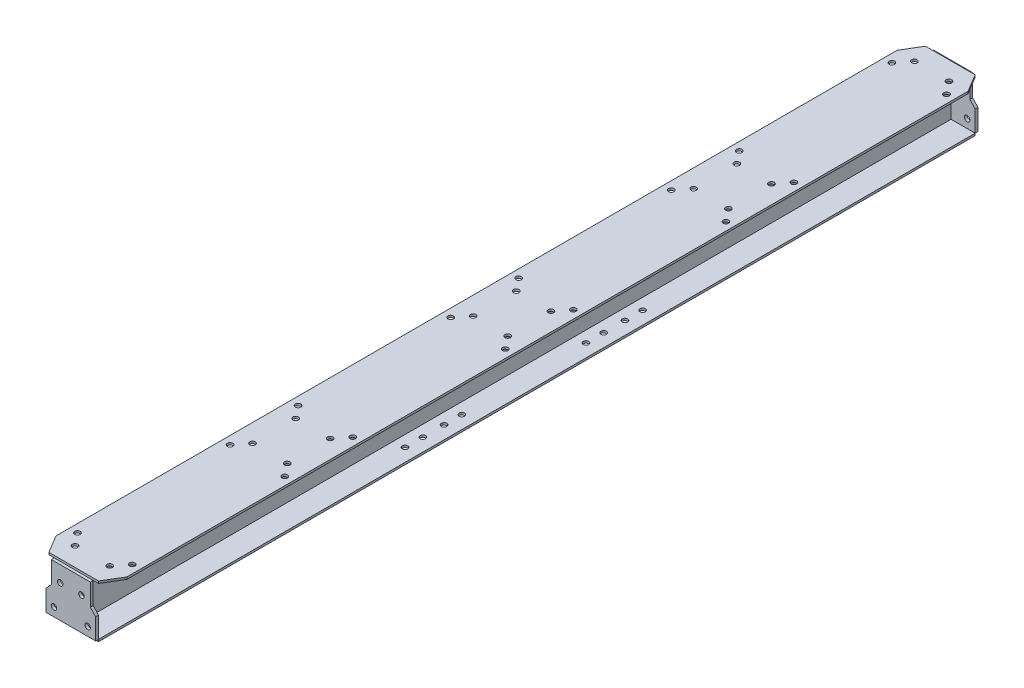
from build123d import *

# Parameters (mm, degrees)
EXTRUDE_1_DEPTH      = 2472
EXTRUDE_2_DEPTH      = 16
SKETCH_5_R           = 15.5
CUT_EXTRUDE_5_DEPTH  = 16
SKETCH_4_R           = 15.5
CUT_EXTRUDE_3_DEPTH  = 2501.439211419
CUT_EXTRUDE_6_DEPTH  = 2501.439211419
SKETCH_7_R           = 15.5
CUT_EXTRUDE_7_DEPTH  = 16
MIRROR_START         = 136.5
MIRROR_1_OUTLINE_R   = 15.5
MIRROR_1_DEPTH       = 12
MIRROR_START_2       = -148.5
MIRROR_1_2_OUTLINE_W = 280
MIRROR_1_2_OUTLINE_H = 2472
MIRROR_1_2_OUTLINE_R = 15.5
MIRROR_1_2_DEPTH     = 12
MIRROR_START_3       = -136.5
MIRROR_1_3_OUTLINE_W = 8
MIRROR_1_3_OUTLINE_H = 2472
MIRROR_1_3_DEPTH     = 273


# Read off the part's stored shape, not the designer's step: 镜向1
with BuildPart() as part:
    # 草图2 → 拉伸1 (new body)
    with BuildSketch(Plane.XY):
        Polygon((-4, 136.5), (-4, -136.5), (-140, -136.5), (-140, -148.5), (140, -148.5), (140, -136.5), (4, -136.5), (4, 136.5), (200, 136.5), (200, 148.5), (-200, 148.5), (-200, 136.5), align=None)
    extrude(amount=EXTRUDE_1_DEPTH)

    # 草图5 → 拉伸5 (cut)
    with BuildSketch(Plane(origin=(0, 148.5, 0), x_dir=(-1, 0, 0), z_dir=(0, 1, 0))):
        with Locations(Location((97.738221798, 2366.413652083, 0), (0, 0, 90))):
            Circle(SKETCH_5_R)
        with Locations(Location((154.125657451, 2296.267682131, 0), (0, 0, 90))):
            Circle(SKETCH_5_R)
        with Locations(Location((97.738221798, 1122.413652083, 0), (0, 0, 90))):
            Circle(SKETCH_5_R)
        with Locations(Location((154.125657451, 1052.267682131, 0), (0, 0, 90))):
            Circle(SKETCH_5_R)
        with Locations(Location((-97.738221798, 1365.586347917, 0), (0, 0, 90))):
            Circle(SKETCH_5_R)
        with Locations(Location((-154.125657451, 1435.732317869, 0), (0, 0, 90))):
            Circle(SKETCH_5_R)
        with Locations((154.125657451, 1435.732317869)):
            Circle(SKETCH_5_R)
        with Locations((97.738221798, 1365.586347917)):
            Circle(SKETCH_5_R)
        with Locations((-154.125657451, 1052.267682131)):
            Circle(SKETCH_5_R)
        with Locations((-97.738221798, 1122.413652083)):
            Circle(SKETCH_5_R)
        with Locations((-154.125657451, 2296.267682131)):
            Circle(SKETCH_5_R)
        with Locations((-97.738221798, 2366.413652083)):
            Circle(SKETCH_5_R)
        with Locations(Location((-97.738221798, 121.586347917, 0), (0, 0, 90))):
            Circle(SKETCH_5_R)
        with Locations(Location((-154.125657451, 191.732317869, 0), (0, 0, 90))):
            Circle(SKETCH_5_R)
        with Locations((154.125657451, 191.732317869)):
            Circle(SKETCH_5_R)
        with Locations((97.738221798, 121.586347917)):
            Circle(SKETCH_5_R)
    extrude(amount=-CUT_EXTRUDE_5_DEPTH, mode=Mode.SUBTRACT)

    # 草图6 → 拉伸6 (cut, through all)
    with BuildSketch(Plane(origin=(0, 0, 0), x_dir=(1, 0, 0), z_dir=(0, 1, 0))):
        Polygon((200, -2472), (140, -2472), (200, -2372), align=None)
        Polygon((-200, -2472), (-200, -2372), (-140, -2472), align=None)
    extrude(amount=CUT_EXTRUDE_6_DEPTH, mode=Mode.SUBTRACT)

    # 草图7 → 拉伸7 (cut)
    with BuildSketch(Plane(origin=(0, -136.5, 0), x_dir=(1, 0, 0), z_dir=(0, 1, 0))):
        with Locations(Location((67, -670, 0), (0, 0, 270))):
            Circle(SKETCH_7_R)
        with Locations(Location((67, -570, 0), (0, 0, 270))):
            Circle(SKETCH_7_R)
        with Locations(Location((67, -450, 0), (0, 0, 270))):
            Circle(SKETCH_7_R)
        with Locations(Location((67, -350, 0), (0, 0, 270))):
            Circle(SKETCH_7_R)
        with Locations(Location((-67, -350, 0), (0, 0, 180))):
            Circle(SKETCH_7_R)
        with Locations(Location((-67, -450, 0), (0, 0, 180))):
            Circle(SKETCH_7_R)
        with Locations(Location((-67, -570, 0), (0, 0, 180))):
            Circle(SKETCH_7_R)
        with Locations(Location((-67, -670, 0), (0, 0, 180))):
            Circle(SKETCH_7_R)
    extrude(amount=-CUT_EXTRUDE_7_DEPTH, mode=Mode.SUBTRACT)

    # 镜向1 outline → 镜向1 (add)
    with BuildSketch(Plane(origin=(0, 0, 0), x_dir=(1, 0, 0), z_dir=(0, 1, 0)).offset(MIRROR_START)):
        Polygon((-200, 2372), (-200, 0), (200, 0), (200, 2372), (140, 2472), (-140, 2472), align=None)
        with Locations((-154.125657451, 2296.267682131)):
            Circle(MIRROR_1_OUTLINE_R, mode=Mode.SUBTRACT)
        with Locations((-154.125657451, 1435.732317869)):
            Circle(MIRROR_1_OUTLINE_R, mode=Mode.SUBTRACT)
        with Locations((-154.125657451, 1052.267682131)):
            Circle(MIRROR_1_OUTLINE_R, mode=Mode.SUBTRACT)
        with Locations((-154.125657451, 191.732317869)):
            Circle(MIRROR_1_OUTLINE_R, mode=Mode.SUBTRACT)
        with Locations((-97.738221798, 1122.413652083)):
            Circle(MIRROR_1_OUTLINE_R, mode=Mode.SUBTRACT)
        with Locations((-97.738221798, 1365.586347917)):
            Circle(MIRROR_1_OUTLINE_R, mode=Mode.SUBTRACT)
        with Locations((-97.738221798, 2366.413652083)):
            Circle(MIRROR_1_OUTLINE_R, mode=Mode.SUBTRACT)
        with Locations((-97.738221798, 121.586347917)):
            Circle(MIRROR_1_OUTLINE_R, mode=Mode.SUBTRACT)
        with Locations((97.738221798, 2366.413652083)):
            Circle(MIRROR_1_OUTLINE_R, mode=Mode.SUBTRACT)
        with Locations((154.125657451, 2296.267682131)):
            Circle(MIRROR_1_OUTLINE_R, mode=Mode.SUBTRACT)
        with Locations((154.125657451, 1435.732317869)):
            Circle(MIRROR_1_OUTLINE_R, mode=Mode.SUBTRACT)
        with Locations((154.125657451, 1052.267682131)):
            Circle(MIRROR_1_OUTLINE_R, mode=Mode.SUBTRACT)
        with Locations((154.125657451, 191.732317869)):
            Circle(MIRROR_1_OUTLINE_R, mode=Mode.SUBTRACT)
        with Locations((97.738221798, 121.586347917)):
            Circle(MIRROR_1_OUTLINE_R, mode=Mode.SUBTRACT)
        with Locations((97.738221798, 1122.413652083)):
            Circle(MIRROR_1_OUTLINE_R, mode=Mode.SUBTRACT)
        with Locations((97.738221798, 1365.586347917)):
            Circle(MIRROR_1_OUTLINE_R, mode=Mode.SUBTRACT)
    extrude(amount=MIRROR_1_DEPTH)

    # Mirror 1 2 outline → Mirror 1 2 (add)
    with BuildSketch(Plane(origin=(0, 0, 0), x_dir=(1, 0, 0), z_dir=(0, 1, 0)).offset(MIRROR_START_2)):
        with Locations((0, 1236)):
            Rectangle(MIRROR_1_2_OUTLINE_W, MIRROR_1_2_OUTLINE_H)
        with Locations((-67, 350)):
            Circle(MIRROR_1_2_OUTLINE_R, mode=Mode.SUBTRACT)
        with Locations((-67, 450)):
            Circle(MIRROR_1_2_OUTLINE_R, mode=Mode.SUBTRACT)
        with Locations((-67, 570)):
            Circle(MIRROR_1_2_OUTLINE_R, mode=Mode.SUBTRACT)
        with Locations((-67, 670)):
            Circle(MIRROR_1_2_OUTLINE_R, mode=Mode.SUBTRACT)
        with Locations((67, 350)):
            Circle(MIRROR_1_2_OUTLINE_R, mode=Mode.SUBTRACT)
        with Locations((67, 450)):
            Circle(MIRROR_1_2_OUTLINE_R, mode=Mode.SUBTRACT)
        with Locations((67, 570)):
            Circle(MIRROR_1_2_OUTLINE_R, mode=Mode.SUBTRACT)
        with Locations((67, 670)):
            Circle(MIRROR_1_2_OUTLINE_R, mode=Mode.SUBTRACT)
    extrude(amount=MIRROR_1_2_DEPTH)

    # Mirror 1 3 outline → Mirror 1 3 (add)
    with BuildSketch(Plane(origin=(0, 0, 0), x_dir=(1, 0, 0), z_dir=(0, 1, 0)).offset(MIRROR_START_3)):
        with Locations((0, 1236)):
            Rectangle(MIRROR_1_3_OUTLINE_W, MIRROR_1_3_OUTLINE_H)
    extrude(amount=MIRROR_1_3_DEPTH)


with BuildPart() as body_2:
    # 草图3 → 拉伸2 (new body)
    with BuildSketch(Plane.XY.offset(2472)):
        Polygon((-110, 136.5), (110, 136.5), (110, 13.5), (140, -18.5), (140, -136.5), (-140, -136.5), (-140, -18.5), (-110, 13.5), align=None)
    extrude(amount=EXTRUDE_2_DEPTH)

    # 草图4 → 拉伸3 (cut, through all)
    with BuildSketch(Plane.XY.offset(2488)):
        with Locations((-60, 47.5)):
            Circle(SKETCH_4_R)
        with Locations((-95, -87.5)):
            Circle(SKETCH_4_R)
        with Locations(Location((95, -87.5, 0), (0, 0, 180))):
            Circle(SKETCH_4_R)
        with Locations(Location((60, 47.5, 0), (0, 0, 180))):
            Circle(SKETCH_4_R)
    extrude(amount=-CUT_EXTRUDE_3_DEPTH, mode=Mode.SUBTRACT)


with BuildPart() as body_3:
    # 镜向2: mirrored copy
    add(body_2.part.mirror(Plane.XY))


solid = Compound([part.part, body_2.part, body_3.part])
